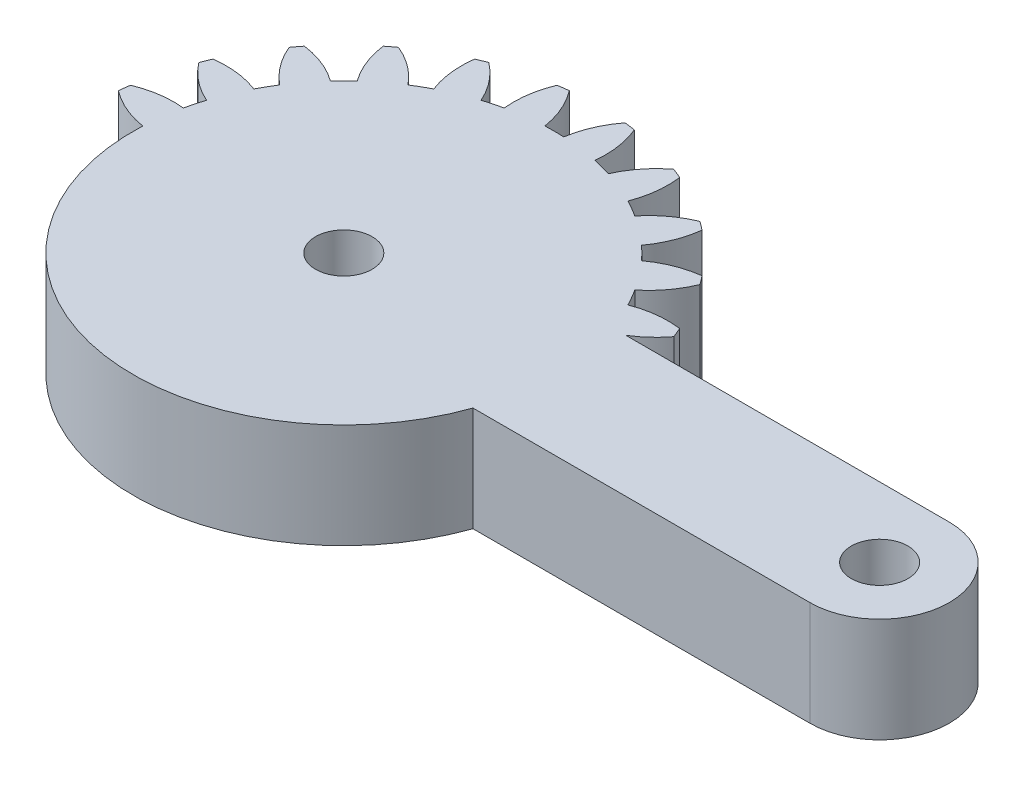
from build123d import *
from build123d.topology import SkipClean

# Parameters (mm, degrees)
SKETCH1_R            = 1.625
BOSS_EXTRUDE1_DEPTH  = 4
CUT_EXTRUDE1_START   = -10
CUT_EXTRUDE1_DEPTH   = 10
MOVE_START           = -2
MOVE_FACE1_OUTLINE_R = 1.625
MOVE_FACE1_DEPTH     = 2


# Read off the part's stored shape, not the designer's step: Move Face1
with BuildPart() as part:
    # Sketch1 → Boss-Extrude1 (new body)
    with BuildSketch(Plane(origin=(0, 0, 0), x_dir=(1, 0, 0), z_dir=(0, 1, 0))):
        with BuildLine():
            Line((20.643657446, 4), (2.081641936, 4))
            ThreePointArc((2.081641936, 4), (2.861028333, 4.588201733), (3.521749436, 5.30713988))
            ThreePointArc((3.521749436, 5.30713988), (3.405395609, 5.596745198), (3.282888305, 5.883801663))
            ThreePointArc((3.282888305, 5.883801663), (1.93527598, 5.894040025), (0.627094961, 5.57027124))
            ThreePointArc((0.627094961, 5.57027124), (0.366286148, 6.046375), (0.084372603, 6.510293938))
            ThreePointArc((0.084372603, 6.510293938), (1.018855105, 7.48132754), (1.683794586, 8.65351323))
            ThreePointArc((1.683794586, 8.65351323), (1.496450048, 8.903135899), (1.303821399, 9.148703928))
            ThreePointArc((1.303821399, 9.148703928), (-0.000522033, 8.809805691), (-1.180330337, 8.158486898))
            ThreePointArc((-1.180330337, 8.158486898), (-1.555477026, 8.550865528), (-1.947855656, 8.926012217))
            ThreePointArc((-1.947855656, 8.926012217), (-1.296536862, 10.105820521), (-0.957638625, 11.410163953))
            ThreePointArc((-0.957638625, 11.410163953), (-1.203206655, 11.602792602), (-1.452829324, 11.79013714))
            ThreePointArc((-1.452829324, 11.79013714), (-2.625015014, 11.125197659), (-3.596048616, 10.190715157))
            ThreePointArc((-3.596048616, 10.190715157), (-4.059967554, 10.472628702), (-4.536071314, 10.733437515))
            ThreePointArc((-4.536071314, 10.733437515), (-4.212302529, 12.041618533), (-4.222540891, 13.389230859))
            ThreePointArc((-4.222540891, 13.389230859), (-4.509597355, 13.511738163), (-4.799202674, 13.62809199))
            ThreePointArc((-4.799202674, 13.62809199), (-5.759348103, 12.682425791), (-6.455432668, 11.528463019))
            ThreePointArc((-6.455432668, 11.528463019), (-6.976508546, 11.680699536), (-7.503891752, 11.809396783))
            ThreePointArc((-7.503891752, 11.809396783), (-7.529737283, 13.156800143), (-7.888414517, 14.455843809))
            ThreePointArc((-7.888414517, 14.455843809), (-8.197396993, 14.499881098), (-8.507248835, 14.537314892))
            ThreePointArc((-8.507248835, 14.537314892), (-9.18992168, 13.375367565), (-9.563620196, 12.080565177))
            ThreePointArc((-9.563620196, 12.080565177), (-10.106342554, 12.09275), (-10.649064912, 12.080565177))
            ThreePointArc((-10.649064912, 12.080565177), (-11.022763428, 13.375367565), (-11.705436272, 14.537314892))
            ThreePointArc((-11.705436272, 14.537314892), (-12.015288115, 14.499881098), (-12.324270591, 14.455843809))
            ThreePointArc((-12.324270591, 14.455843809), (-12.682947825, 13.156800143), (-12.708793355, 11.809396783))
            ThreePointArc((-12.708793355, 11.809396783), (-13.236176561, 11.680699536), (-13.757252439, 11.528463019))
            ThreePointArc((-13.757252439, 11.528463019), (-14.453337005, 12.682425791), (-15.413482434, 13.62809199))
            ThreePointArc((-15.413482434, 13.62809199), (-15.703087752, 13.511738163), (-15.990144217, 13.389230859))
            ThreePointArc((-15.990144217, 13.389230859), (-16.000382579, 12.041618533), (-15.676613793, 10.733437515))
            ThreePointArc((-15.676613793, 10.733437515), (-16.152717554, 10.472628702), (-16.616636492, 10.190715157))
            ThreePointArc((-16.616636492, 10.190715157), (-17.587670094, 11.125197659), (-18.759855783, 11.79013714))
            ThreePointArc((-18.759855783, 11.79013714), (-19.009478453, 11.602792602), (-19.255046482, 11.410163953))
            ThreePointArc((-19.255046482, 11.410163953), (-18.916148245, 10.105820521), (-18.264829452, 8.926012217))
            ThreePointArc((-18.264829452, 8.926012217), (-18.657208082, 8.550865528), (-19.032354771, 8.158486898))
            ThreePointArc((-19.032354771, 8.158486898), (-20.212163074, 8.809805691), (-21.516506507, 9.148703928))
            ThreePointArc((-21.516506507, 9.148703928), (-21.709135156, 8.903135899), (-21.896479694, 8.65351323))
            ThreePointArc((-21.896479694, 8.65351323), (-21.231540213, 7.48132754), (-20.297057711, 6.510293938))
            ThreePointArc((-20.297057711, 6.510293938), (-20.578971255, 6.046375), (-20.839780068, 5.57027124))
            ThreePointArc((-20.839780068, 5.57027124), (-22.147961087, 5.894040025), (-23.495573413, 5.883801663))
            ThreePointArc((-23.495573413, 5.883801663), (-23.618080717, 5.596745198), (-23.734434544, 5.30713988))
            ThreePointArc((-23.734434544, 5.30713988), (-22.788768345, 4.346994451), (-21.634805572, 3.650909885))
            ThreePointArc((-21.634805572, 3.650909885), (-21.78704209, 3.129834008), (-21.915739337, 2.602450802))
            ThreePointArc((-21.915739337, 2.602450802), (-23.263142697, 2.576605271), (-24.562186363, 2.217928037))
            ThreePointArc((-24.562186363, 2.217928037), (-24.606223651, 1.908945561), (-24.643657446, 1.599093719))
            ThreePointArc((-24.643657446, 1.599093719), (-23.481710119, 0.916420874), (-22.186907731, 0.542722358))
            ThreePointArc((-22.186907731, 0.542722358), (-22.199092554, 0), (-22.186907731, -0.542722358))
            ThreePointArc((-22.186907731, -0.542722358), (-23.481710119, -0.916420874), (-24.643657446, -1.599093719))
            ThreePointArc((-24.643657446, -1.599093719), (-24.606223651, -1.908945561), (-24.562186363, -2.217928037))
            ThreePointArc((-24.562186363, -2.217928037), (-23.263142697, -2.576605271), (-21.915739337, -2.602450802))
            ThreePointArc((-21.915739337, -2.602450802), (-21.78704209, -3.129834008), (-21.634805572, -3.650909885))
            ThreePointArc((-21.634805572, -3.650909885), (-22.788768345, -4.346994451), (-23.734434544, -5.30713988))
            ThreePointArc((-23.734434544, -5.30713988), (-23.618080717, -5.596745198), (-23.495573413, -5.883801663))
            ThreePointArc((-23.495573413, -5.883801663), (-22.147961087, -5.894040025), (-20.839780068, -5.57027124))
            ThreePointArc((-20.839780068, -5.57027124), (-20.578971255, -6.046375), (-20.297057711, -6.510293938))
            ThreePointArc((-20.297057711, -6.510293938), (-21.231540213, -7.48132754), (-21.896479694, -8.65351323))
            ThreePointArc((-21.896479694, -8.65351323), (-21.709135156, -8.903135899), (-21.516506507, -9.148703928))
            ThreePointArc((-21.516506507, -9.148703928), (-20.212163074, -8.809805691), (-19.032354771, -8.158486898))
            ThreePointArc((-19.032354771, -8.158486898), (-18.657208082, -8.550865528), (-18.264829452, -8.926012217))
            ThreePointArc((-18.264829452, -8.926012217), (-18.916148245, -10.105820521), (-19.255046482, -11.410163953))
            ThreePointArc((-19.255046482, -11.410163953), (-19.009478453, -11.602792602), (-18.759855783, -11.79013714))
            ThreePointArc((-18.759855783, -11.79013714), (-17.587670094, -11.125197659), (-16.616636492, -10.190715157))
            ThreePointArc((-16.616636492, -10.190715157), (-16.152717554, -10.472628702), (-15.676613793, -10.733437515))
            ThreePointArc((-15.676613793, -10.733437515), (-16.000382579, -12.041618533), (-15.990144217, -13.389230859))
            ThreePointArc((-15.990144217, -13.389230859), (-15.703087752, -13.511738163), (-15.413482434, -13.62809199))
            ThreePointArc((-15.413482434, -13.62809199), (-14.453337005, -12.682425791), (-13.757252439, -11.528463019))
            ThreePointArc((-13.757252439, -11.528463019), (-13.236176561, -11.680699536), (-12.708793355, -11.809396783))
            ThreePointArc((-12.708793355, -11.809396783), (-12.682947825, -13.156800143), (-12.324270591, -14.455843809))
            ThreePointArc((-12.324270591, -14.455843809), (-12.015288115, -14.499881098), (-11.705436272, -14.537314892))
            ThreePointArc((-11.705436272, -14.537314892), (-11.022763428, -13.375367565), (-10.649064912, -12.080565177))
            ThreePointArc((-10.649064912, -12.080565177), (-10.106342554, -12.09275), (-9.563620196, -12.080565177))
            ThreePointArc((-9.563620196, -12.080565177), (-9.18992168, -13.375367565), (-8.507248835, -14.537314892))
            ThreePointArc((-8.507248835, -14.537314892), (-8.197396993, -14.499881098), (-7.888414517, -14.455843809))
            ThreePointArc((-7.888414517, -14.455843809), (-7.529737283, -13.156800143), (-7.503891752, -11.809396783))
            ThreePointArc((-7.503891752, -11.809396783), (-6.976508546, -11.680699536), (-6.455432668, -11.528463019))
            ThreePointArc((-6.455432668, -11.528463019), (-5.759348103, -12.682425791), (-4.799202674, -13.62809199))
            ThreePointArc((-4.799202674, -13.62809199), (-4.509597355, -13.511738163), (-4.222540891, -13.389230859))
            ThreePointArc((-4.222540891, -13.389230859), (-4.212302529, -12.041618533), (-4.536071314, -10.733437515))
            ThreePointArc((-4.536071314, -10.733437515), (-4.059967554, -10.472628702), (-3.596048616, -10.190715157))
            ThreePointArc((-3.596048616, -10.190715157), (-2.625015014, -11.125197659), (-1.452829324, -11.79013714))
            ThreePointArc((-1.452829324, -11.79013714), (-1.203206655, -11.602792602), (-0.957638625, -11.410163953))
            ThreePointArc((-0.957638625, -11.410163953), (-1.296536862, -10.105820521), (-1.947855656, -8.926012217))
            ThreePointArc((-1.947855656, -8.926012217), (-1.555477026, -8.550865528), (-1.180330337, -8.158486898))
            ThreePointArc((-1.180330337, -8.158486898), (-0.000522033, -8.809805691), (1.303821399, -9.148703928))
            ThreePointArc((1.303821399, -9.148703928), (1.496450048, -8.903135899), (1.683794586, -8.65351323))
            ThreePointArc((1.683794586, -8.65351323), (1.018855105, -7.48132754), (0.084372603, -6.510293938))
            ThreePointArc((0.084372603, -6.510293938), (0.366286148, -6.046375), (0.627094961, -5.57027124))
            ThreePointArc((0.627094961, -5.57027124), (1.93527598, -5.894040025), (3.282888305, -5.883801663))
            ThreePointArc((3.282888305, -5.883801663), (3.405395609, -5.596745198), (3.521749436, -5.30713988))
            ThreePointArc((3.521749436, -5.30713988), (2.861028333, -4.588201733), (2.081641936, -4))
            Line((2.081641936, -4), (20.643657446, -4))
            ThreePointArc((20.643657446, -4), (24.643657446, 0), (20.643657446, 4))
        make_face()
        with Locations(Location((-10.106342554, 0, 0), (0, 0, 270))):
            Circle(SKETCH1_R, mode=Mode.SUBTRACT)
        with Locations(Location((20.643657446, 0, 0), (0, 0, 270))):
            Circle(SKETCH1_R, mode=Mode.SUBTRACT)
    extrude(amount=BOSS_EXTRUDE1_DEPTH)

    # Sketch2 → Cut-Extrude1 (cut)
    with SkipClean():  # the faces are left unmerged after this step: merging them gives an invalid solid
        with BuildSketch(Plane(origin=(0, 4, 0), x_dir=(1, 0, 0), z_dir=(0, 1, 0)).offset(CUT_EXTRUDE1_START)):
            with BuildLine():
                ThreePointArc((-24.562186363, -2.217928037), (-23.263142697, -2.576605271), (-21.915739337, -2.602450802))
                ThreePointArc((-21.915739337, -2.602450802), (-22.095637401, -1.578420611), (-22.186907731, -0.542722358))
                ThreePointArc((-22.186907731, -0.542722358), (-23.481710119, -0.916420874), (-24.643657446, -1.599093719))
                ThreePointArc((-24.643657446, -1.599093719), (-24.606223651, -1.908945561), (-24.562186363, -2.217928037))
            make_face()
            with BuildLine():
                ThreePointArc((-23.495573413, -5.883801663), (-22.147961087, -5.894040025), (-20.839780068, -5.57027124))
                ThreePointArc((-20.839780068, -5.57027124), (-21.278586771, -4.627695077), (-21.634805572, -3.650909885))
                ThreePointArc((-21.634805572, -3.650909885), (-22.788768345, -4.346994451), (-23.734434544, -5.30713988))
                ThreePointArc((-23.734434544, -5.30713988), (-23.618080717, -5.596745198), (-23.495573413, -5.883801663))
            make_face()
            with BuildLine():
                ThreePointArc((-21.516506507, -9.148703928), (-20.212163074, -8.809805691), (-19.032354771, -8.158486898))
                ThreePointArc((-19.032354771, -8.158486898), (-19.70016616, -7.361599771), (-20.297057711, -6.510293938))
                ThreePointArc((-20.297057711, -6.510293938), (-21.231540213, -7.48132754), (-21.896479694, -8.65351323))
                ThreePointArc((-21.896479694, -8.65351323), (-21.709135156, -8.903135899), (-21.516506507, -9.148703928))
            make_face()
            with BuildLine():
                ThreePointArc((-18.759855783, -11.79013714), (-17.587670094, -11.125197659), (-16.616636492, -10.190715157))
                ThreePointArc((-16.616636492, -10.190715157), (-17.467942324, -9.593823606), (-18.264829452, -8.926012217))
                ThreePointArc((-18.264829452, -8.926012217), (-18.916148245, -10.105820521), (-19.255046482, -11.410163953))
                ThreePointArc((-19.255046482, -11.410163953), (-19.009478453, -11.602792602), (-18.759855783, -11.79013714))
            make_face()
            with BuildLine():
                ThreePointArc((-15.413482434, -13.62809199), (-14.453337005, -12.682425791), (-13.757252439, -11.528463019))
                ThreePointArc((-13.757252439, -11.528463019), (-14.734037631, -11.172244217), (-15.676613793, -10.733437515))
                ThreePointArc((-15.676613793, -10.733437515), (-16.000382579, -12.041618533), (-15.990144217, -13.389230859))
                ThreePointArc((-15.990144217, -13.389230859), (-15.703087752, -13.511738163), (-15.413482434, -13.62809199))
            make_face()
            with BuildLine():
                ThreePointArc((-11.705436272, -14.537314892), (-11.022763428, -13.375367565), (-10.649064912, -12.080565177))
                ThreePointArc((-10.649064912, -12.080565177), (-11.684763165, -11.989294847), (-12.708793355, -11.809396783))
                ThreePointArc((-12.708793355, -11.809396783), (-12.682947825, -13.156800143), (-12.324270591, -14.455843809))
                ThreePointArc((-12.324270591, -14.455843809), (-12.015288115, -14.499881098), (-11.705436272, -14.537314892))
            make_face()
            with BuildLine():
                ThreePointArc((-7.888414517, -14.455843809), (-7.529737283, -13.156800143), (-7.503891752, -11.809396783))
                ThreePointArc((-7.503891752, -11.809396783), (-8.527921943, -11.989294847), (-9.563620196, -12.080565177))
                ThreePointArc((-9.563620196, -12.080565177), (-9.18992168, -13.375367565), (-8.507248835, -14.537314892))
                ThreePointArc((-8.507248835, -14.537314892), (-8.197396993, -14.499881098), (-7.888414517, -14.455843809))
            make_face()
            with BuildLine():
                ThreePointArc((-4.222540891, -13.389230859), (-4.212302529, -12.041618533), (-4.536071314, -10.733437515))
                ThreePointArc((-4.536071314, -10.733437515), (-5.478647477, -11.172244217), (-6.455432668, -11.528463019))
                ThreePointArc((-6.455432668, -11.528463019), (-5.759348103, -12.682425791), (-4.799202674, -13.62809199))
                ThreePointArc((-4.799202674, -13.62809199), (-4.509597355, -13.511738163), (-4.222540891, -13.389230859))
            make_face()
            with BuildLine():
                ThreePointArc((-0.957638625, -11.410163953), (-1.296536862, -10.105820521), (-1.947855656, -8.926012217))
                ThreePointArc((-1.947855656, -8.926012217), (-2.744742783, -9.593823606), (-3.596048616, -10.190715157))
                ThreePointArc((-3.596048616, -10.190715157), (-2.625015014, -11.125197659), (-1.452829324, -11.79013714))
                ThreePointArc((-1.452829324, -11.79013714), (-1.203206655, -11.602792602), (-0.957638625, -11.410163953))
            make_face()
            with BuildLine():
                ThreePointArc((1.683794586, -8.65351323), (1.018855105, -7.48132754), (0.084372603, -6.510293938))
                ThreePointArc((0.084372603, -6.510293938), (-0.512518948, -7.361599771), (-1.180330337, -8.158486898))
                ThreePointArc((-1.180330337, -8.158486898), (-0.000522033, -8.809805691), (1.303821399, -9.148703928))
                ThreePointArc((1.303821399, -9.148703928), (1.496450048, -8.903135899), (1.683794586, -8.65351323))
            make_face()
            with BuildLine():
                ThreePointArc((3.521749436, -5.30713988), (2.861028333, -4.588201733), (2.081641936, -4))
                Line((2.081641936, -4), (1.305695063, -4))
                ThreePointArc((1.305695063, -4), (0.994195953, -4.797149927), (0.627094961, -5.57027124))
                ThreePointArc((0.627094961, -5.57027124), (1.93527598, -5.894040025), (3.282888305, -5.883801663))
                ThreePointArc((3.282888305, -5.883801663), (3.405395609, -5.596745198), (3.521749436, -5.30713988))
            make_face()
        extrude(amount=CUT_EXTRUDE1_DEPTH, mode=Mode.SUBTRACT)

    # Move Face1 outline → Move Face1 (add)
    with SkipClean():  # the faces are left unmerged after this step: merging them gives an invalid solid
        with BuildSketch(Plane(origin=(0, 0, 0), x_dir=(1, 0, 0), z_dir=(0, 1, 0)).offset(MOVE_START)):
            with BuildLine():
                ThreePointArc((20.643657446, -4), (24.643657446, 0), (20.643657446, 4))
                Line((20.643657446, 4), (2.081641936, 4))
                ThreePointArc((2.081641936, 4), (2.861028333, 4.588201733), (3.521749436, 5.30713988))
                ThreePointArc((3.521749436, 5.30713988), (3.405395609, 5.596745198), (3.282888305, 5.883801663))
                ThreePointArc((3.282888305, 5.883801663), (1.93527598, 5.894040025), (0.627094961, 5.57027124))
                ThreePointArc((0.627094961, 5.57027124), (0.366286148, 6.046375), (0.084372603, 6.510293938))
                ThreePointArc((0.084372603, 6.510293938), (1.018855105, 7.48132754), (1.683794586, 8.65351323))
                ThreePointArc((1.683794586, 8.65351323), (1.496450048, 8.903135899), (1.303821399, 9.148703928))
                ThreePointArc((1.303821399, 9.148703928), (-0.000522033, 8.809805691), (-1.180330337, 8.158486898))
                ThreePointArc((-1.180330337, 8.158486898), (-1.555477026, 8.550865528), (-1.947855656, 8.926012217))
                ThreePointArc((-1.947855656, 8.926012217), (-1.296536862, 10.105820521), (-0.957638625, 11.410163953))
                ThreePointArc((-0.957638625, 11.410163953), (-1.203206654, 11.602792602), (-1.452829324, 11.79013714))
                ThreePointArc((-1.452829324, 11.79013714), (-2.625015014, 11.125197659), (-3.596048616, 10.190715157))
                ThreePointArc((-3.596048616, 10.190715157), (-4.059967554, 10.472628702), (-4.536071314, 10.733437515))
                ThreePointArc((-4.536071314, 10.733437515), (-4.212302529, 12.041618534), (-4.222540891, 13.389230859))
                ThreePointArc((-4.222540891, 13.389230859), (-4.509597356, 13.511738163), (-4.799202674, 13.62809199))
                ThreePointArc((-4.799202674, 13.62809199), (-5.759348103, 12.682425792), (-6.455432668, 11.528463019))
                ThreePointArc((-6.455432668, 11.528463019), (-6.976508546, 11.680699536), (-7.503891752, 11.809396783))
                ThreePointArc((-7.503891752, 11.809396783), (-7.529737283, 13.156800143), (-7.888414517, 14.455843809))
                ThreePointArc((-7.888414517, 14.455843809), (-8.197396993, 14.499881098), (-8.507248835, 14.537314892))
                ThreePointArc((-8.507248835, 14.537314892), (-9.18992168, 13.375367565), (-9.563620196, 12.080565177))
                ThreePointArc((-9.563620196, 12.080565177), (-10.106342554, 12.09275), (-10.649064912, 12.080565177))
                ThreePointArc((-10.649064912, 12.080565177), (-11.022763428, 13.375367565), (-11.705436272, 14.537314892))
                ThreePointArc((-11.705436272, 14.537314892), (-12.015288115, 14.499881098), (-12.324270591, 14.455843809))
                ThreePointArc((-12.324270591, 14.455843809), (-12.682947825, 13.156800143), (-12.708793355, 11.809396783))
                ThreePointArc((-12.708793355, 11.809396783), (-13.236176561, 11.680699536), (-13.757252439, 11.528463019))
                ThreePointArc((-13.757252439, 11.528463019), (-14.453337005, 12.682425791), (-15.413482434, 13.62809199))
                ThreePointArc((-15.413482434, 13.62809199), (-15.703087752, 13.511738163), (-15.990144217, 13.389230859))
                ThreePointArc((-15.990144217, 13.389230859), (-16.000382579, 12.041618533), (-15.676613793, 10.733437515))
                ThreePointArc((-15.676613793, 10.733437515), (-16.152717554, 10.472628702), (-16.616636492, 10.190715157))
                ThreePointArc((-16.616636492, 10.190715157), (-17.587670094, 11.125197659), (-18.759855783, 11.79013714))
                ThreePointArc((-18.759855783, 11.79013714), (-19.009478453, 11.602792602), (-19.255046482, 11.410163953))
                ThreePointArc((-19.255046482, 11.410163953), (-18.916148245, 10.105820521), (-18.264829452, 8.926012217))
                ThreePointArc((-18.264829452, 8.926012217), (-18.657208082, 8.550865528), (-19.032354771, 8.158486898))
                ThreePointArc((-19.032354771, 8.158486898), (-20.212163075, 8.809805691), (-21.516506507, 9.148703928))
                ThreePointArc((-21.516506507, 9.148703928), (-21.709135156, 8.903135899), (-21.896479694, 8.65351323))
                ThreePointArc((-21.896479694, 8.65351323), (-21.231540213, 7.48132754), (-20.297057711, 6.510293938))
                ThreePointArc((-20.297057711, 6.510293938), (-20.578971255, 6.046375), (-20.839780068, 5.57027124))
                ThreePointArc((-20.839780068, 5.57027124), (-22.147961087, 5.894040025), (-23.495573413, 5.883801663))
                ThreePointArc((-23.495573413, 5.883801663), (-23.618080717, 5.596745198), (-23.734434544, 5.30713988))
                ThreePointArc((-23.734434544, 5.30713988), (-22.788768345, 4.346994451), (-21.634805572, 3.650909885))
                ThreePointArc((-21.634805572, 3.650909885), (-21.78704209, 3.129834008), (-21.915739337, 2.602450802))
                ThreePointArc((-21.915739337, 2.602450802), (-23.263142697, 2.576605271), (-24.562186363, 2.217928037))
                ThreePointArc((-24.562186363, 2.217928037), (-24.606223651, 1.908945561), (-24.643657446, 1.599093719))
                ThreePointArc((-24.643657446, 1.599093719), (-23.481710119, 0.916420874), (-22.186907731, 0.542722358))
                ThreePointArc((-22.186907731, 0.542722358), (-12.402167869, -11.872817218), (1.305695063, -4))
                Line((1.305695063, -4), (20.643657446, -4))
            make_face()
            with Locations((-10.106342554, 0)):
                Circle(MOVE_FACE1_OUTLINE_R, mode=Mode.SUBTRACT)
            with Locations((20.643657446, 0)):
                Circle(MOVE_FACE1_OUTLINE_R, mode=Mode.SUBTRACT)
        extrude(amount=MOVE_FACE1_DEPTH)


solid = part.part
